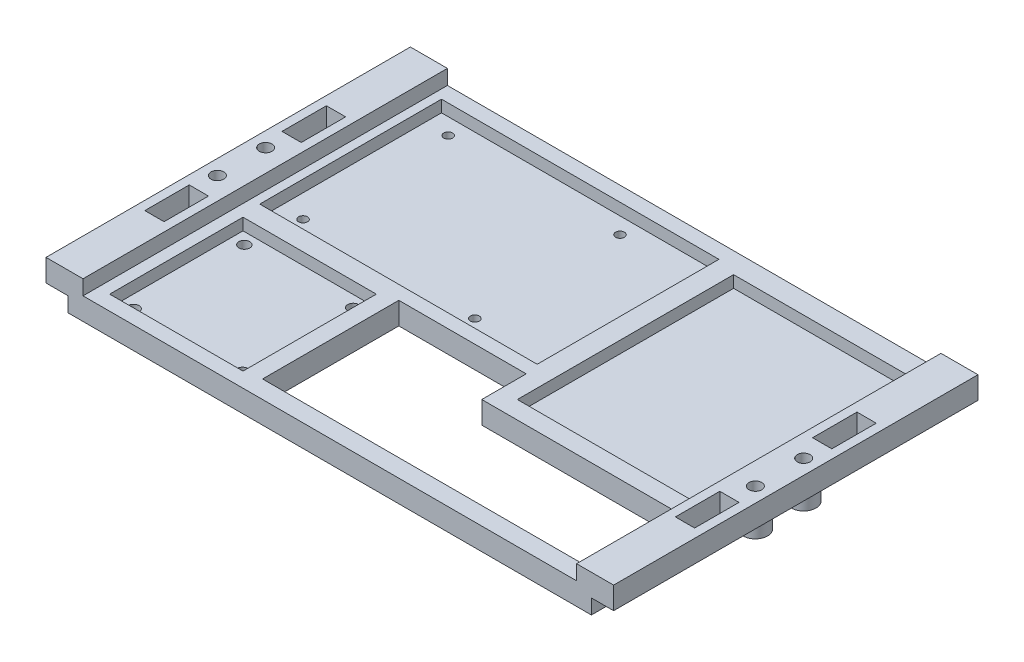
from build123d import *

# Parameters (mm, degrees)
PLATEFRAME_DEPTH          = 150
SKETCH3_R                 = 2.15
HOLESUPPORT_DEPTH         = 7.5
SKETCH4_R                 = 4.15
SKETCH4_R_2               = 2.15
CYLINDRICALSUPPORTS_DEPTH = 12.5
SKETCH5_W                 = 43
SKETCH5_H                 = 43
SKETCH5_W_2               = 89.65
SKETCH5_H_2               = 57.35
SKETCH5_W_3               = 58
SKETCH5_H_3               = 73
ITEMLAYOUT_DEPTH          = 4
HOLECUTOUT_DEPTH          = 7.5
SKETCH7_R                 = 1.5
HOLERASPBERRYPI_DEPTH     = 3.5
SKETCH8_R                 = 1.85
HOLEMOTORDRIVER_DEPTH     = 3.5
SKETCH10_W                = 45
SKETCH10_H                = 45
SKETCH10_W_2              = 43
SKETCH10_H_2              = 43
CUTMOTORDRIVER_DEPTH      = 4
SKETCH11_W                = 93.65
SKETCH11_H                = 61.35
SKETCH11_W_2              = 89.65
SKETCH11_H_2              = 57.35
CUTPASPBERRYPI_DEPTH      = 4
SKETCH12_W                = 191.6
SKETCH12_H                = 13
SKETCH12_H_2              = 14
CUTPLATEEDGES_DEPTH       = 12.5
SKETCH13_W                = 6.5
SKETCH13_H                = 15
CUTSHELLHOLES_DEPTH       = 12.5


with BuildPart() as part:
    # Sketch2 → PlateFrame (new body)
    with BuildSketch(Plane.XY):
        Polygon((179.1, 12.5), (191.6, 12.5), (191.6, 5), (184.1, 5), (184.1, 0), (7.5, 0), (7.5, 5), (0, 5), (0, 12.5), (12.5, 12.5), (12.5, 7.5), (179.1, 7.5), align=None)
    extrude(amount=PLATEFRAME_DEPTH)

    # Sketch3 → HoleSupport (cut)
    with BuildSketch(Plane(origin=(0, 12.5, 0), x_dir=(1, 0, 0), z_dir=(0, 1, 0))):
        with Locations((5, -66.85)):
            Circle(SKETCH3_R)
        with Locations((5, -83.15)):
            Circle(SKETCH3_R)
        with Locations((186.6, -66.85)):
            Circle(SKETCH3_R)
        with Locations((186.6, -83.15)):
            Circle(SKETCH3_R)
    extrude(amount=-HOLESUPPORT_DEPTH, mode=Mode.SUBTRACT)

    # Sketch4 → CylindricalSupports (add)
    # profile 1 of 4: a face of its own
    with BuildSketch(Plane(origin=(0, 12.5, 0), x_dir=(1, 0, 0), z_dir=(0, 1, 0))):
        with Locations((186.6, -66.85)):
            Circle(SKETCH4_R)
        with Locations((186.6, -66.85)):
            Circle(SKETCH4_R_2, mode=Mode.SUBTRACT)
    # profile 2 of 4: a face of its own
    with BuildSketch(Plane(origin=(0, 12.5, 0), x_dir=(1, 0, 0), z_dir=(0, 1, 0))):
        with Locations((186.6, -83.15)):
            Circle(SKETCH4_R)
        with Locations((186.6, -83.15)):
            Circle(SKETCH4_R_2, mode=Mode.SUBTRACT)
    # profile 3 of 4: a face of its own
    with BuildSketch(Plane(origin=(0, 12.5, 0), x_dir=(1, 0, 0), z_dir=(0, 1, 0))):
        with Locations((5, -66.85)):
            Circle(SKETCH4_R)
        with Locations((5, -66.85)):
            Circle(SKETCH4_R_2, mode=Mode.SUBTRACT)
    # profile 4 of 4: a face of its own
    with BuildSketch(Plane(origin=(0, 12.5, 0), x_dir=(1, 0, 0), z_dir=(0, 1, 0))):
        with Locations((5, -83.15)):
            Circle(SKETCH4_R)
        with Locations((5, -83.15)):
            Circle(SKETCH4_R_2, mode=Mode.SUBTRACT)
    extrude(amount=-CYLINDRICALSUPPORTS_DEPTH)

    # Sketch5 → ItemLayout (cut)
    with BuildSketch(Plane(origin=(0, 7.5, 0), x_dir=(1, 0, 0), z_dir=(0, 1, 0))):
        with Locations((39, -108.5)):
            Rectangle(SKETCH5_W, SKETCH5_H)
        with Locations((62.325, -48.675)):
            Rectangle(SKETCH5_W_2, SKETCH5_H_2)
        with Locations((145.1, -56.5)):
            Rectangle(SKETCH5_W_3, SKETCH5_H_3)
    extrude(amount=-ITEMLAYOUT_DEPTH, mode=Mode.SUBTRACT)

    # Sketch6 → HoleCutout (cut)
    with BuildSketch(Plane(origin=(0, 7.5, 0), x_dir=(1, 0, 0), z_dir=(0, 1, 0))):
        Polygon((67.1, -84), (110.1, -84), (110.1, -99), (174.1, -99), (174.1, -130), (110.1, -130), (67.1, -130), align=None)
    extrude(amount=-HOLECUTOUT_DEPTH, mode=Mode.SUBTRACT)

    # Sketch7 → HoleRaspberryPi (cut)
    with BuildSketch(Plane(origin=(0, 3.5, 0), x_dir=(1, 0, 0), z_dir=(0, 1, 0))):
        with Locations((23.26, -23.5)):
            Circle(SKETCH7_R)
        with Locations((23.26, -72.5)):
            Circle(SKETCH7_R)
        with Locations((81.26, -72.5)):
            Circle(SKETCH7_R)
        with Locations((81.26, -23.5)):
            Circle(SKETCH7_R)
    extrude(amount=-HOLERASPBERRYPI_DEPTH, mode=Mode.SUBTRACT)

    # Sketch8 → HoleMotorDriver (cut)
    with BuildSketch(Plane(origin=(0, 3.5, 0), x_dir=(1, 0, 0), z_dir=(0, 1, 0))):
        with Locations((57.56, -127.24)):
            Circle(SKETCH8_R)
        with Locations((57.56, -89.86)):
            Circle(SKETCH8_R)
        with Locations((20.81, -89.86)):
            Circle(SKETCH8_R)
        with Locations((20.81, -127.24)):
            Circle(SKETCH8_R)
    extrude(amount=-HOLEMOTORDRIVER_DEPTH, mode=Mode.SUBTRACT)

    # Sketch10 → CutMotorDriver (cut)
    with BuildSketch(Plane(origin=(0, 7.5, 0), x_dir=(1, 0, 0), z_dir=(0, 1, 0))):
        with Locations((39, -108.5)):
            Rectangle(SKETCH10_W, SKETCH10_H)
        with Locations((39, -108.5)):
            Rectangle(SKETCH10_W_2, SKETCH10_H_2, mode=Mode.SUBTRACT)
    extrude(amount=-CUTMOTORDRIVER_DEPTH, mode=Mode.SUBTRACT)

    # Sketch11 → CutPaspberryPi (cut)
    with BuildSketch(Plane(origin=(0, 7.5, 0), x_dir=(1, 0, 0), z_dir=(0, 1, 0))):
        with Locations((62.325, -48.675)):
            Rectangle(SKETCH11_W, SKETCH11_H)
        with Locations((62.325, -48.675)):
            Rectangle(SKETCH11_W_2, SKETCH11_H_2, mode=Mode.SUBTRACT)
    extrude(amount=-CUTPASPBERRYPI_DEPTH, mode=Mode.SUBTRACT)

    # Sketch12 → CutPlateEdges (cut)
    with BuildSketch(Plane(origin=(0, 12.5, 0), x_dir=(1, 0, 0), z_dir=(0, 1, 0))):
        with Locations((95.8, -6.5)):
            Rectangle(SKETCH12_W, SKETCH12_H)
        with Locations((95.8, -143)):
            Rectangle(SKETCH12_W, SKETCH12_H_2)
    extrude(amount=-CUTPLATEEDGES_DEPTH, mode=Mode.SUBTRACT)

    # Sketch13 → CutShellHoles (cut)
    with BuildSketch(Plane(origin=(0, 12.5, 0), x_dir=(1, 0, 0), z_dir=(0, 1, 0))):
        with Locations((6.25, -51.85)):
            Rectangle(SKETCH13_W, SKETCH13_H)
        with Locations((6.25, -98.15)):
            Rectangle(SKETCH13_W, SKETCH13_H)
        with Locations((185.35, -51.85)):
            Rectangle(SKETCH13_W, SKETCH13_H)
        with Locations((185.35, -98.15)):
            Rectangle(SKETCH13_W, SKETCH13_H)
    extrude(amount=-CUTSHELLHOLES_DEPTH, mode=Mode.SUBTRACT)


solid = part.part
